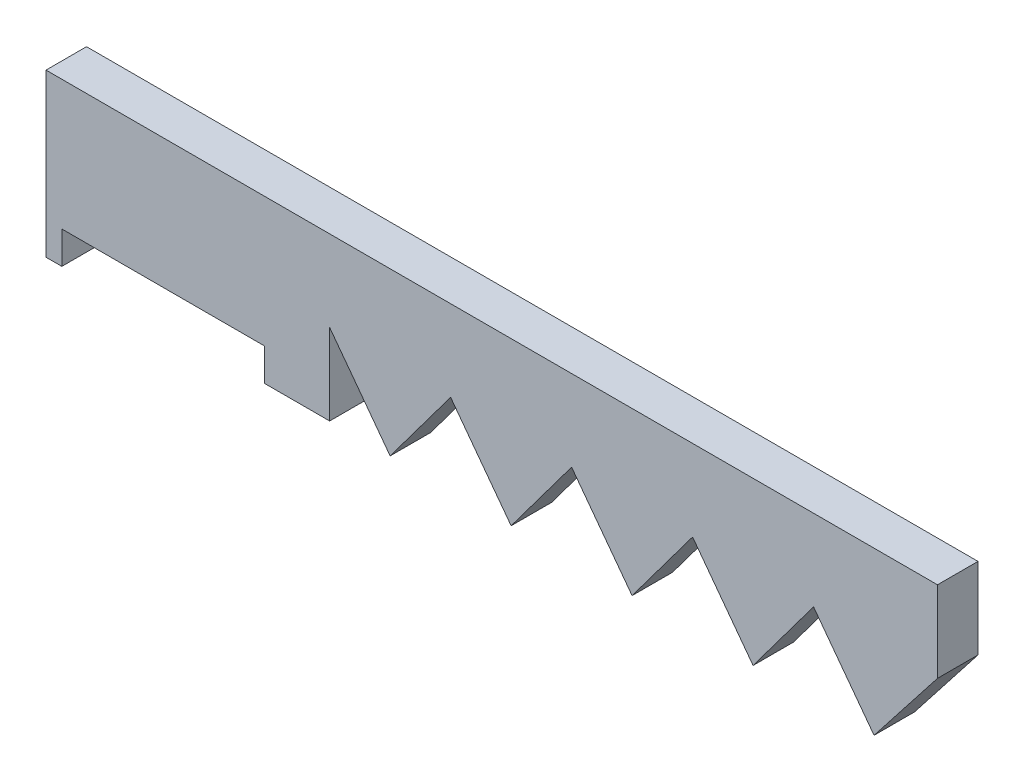
from build123d import *

# Parameters (mm, degrees)
BOSS_EXTRUDE1_DEPTH = 2.54
CUT_EXTRUDE2_DEPTH  = 2.032


with BuildPart() as part:
    # Sketch1 → Boss-Extrude1 (new body)
    with BuildSketch(Plane.XY):
        Polygon((-27.94, 0), (-10.16, 0), (-10.16, 5.08), (-6.368400563, 0), (-2.576801125, 5.08), (1.214798312, 0), (5.006397749, 5.08), (8.797997187, 0), (12.589596624, 5.08), (16.381196061, 0), (20.172795499, 5.08), (23.964394936, 0), (27.94, 5.08), (27.94, 10.16), (-27.94, 10.16), align=None)
    extrude(amount=BOSS_EXTRUDE1_DEPTH)

    # Sketch2 → Cut-Extrude2 (cut)
    with BuildSketch(Plane.XZ):
        with BuildLine():
            Line((-26.946988417, 0), (-14.246988417, 0))
            ThreePointArc((-14.246988417, 0), (-13.671199906, 1.27), (-14.246988417, 2.54))
            Line((-14.246988417, 2.54), (-26.946988417, 2.54))
            Line((-26.946988417, 2.54), (-26.946988417, 0))
        make_face()
    extrude(amount=-CUT_EXTRUDE2_DEPTH, mode=Mode.SUBTRACT)


solid = part.part
